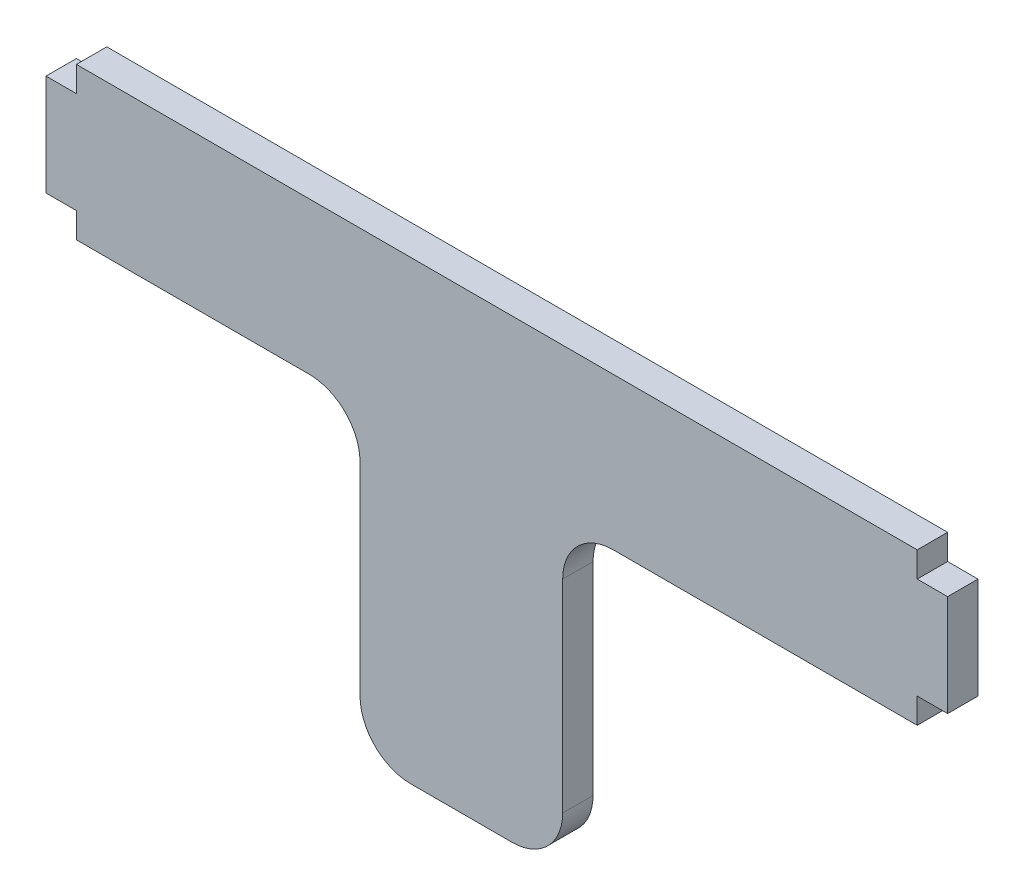
from build123d import *

# Parameters (mm, degrees)
RESSALTO_EXTRUS_O1_DEPTH = 3
FILETE1_R                = 5


with BuildPart() as part:
    # Esboço1 → Ressalto-extrusão1 (new body)
    with BuildSketch(Plane.XY):
        Polygon((6.5, -7.5), (41.5, -7.5), (41.5, -5), (44.5, -5), (44.5, 5), (41.5, 5), (41.5, 7.5), (-41.5, 7.5), (-41.5, 5), (-44.5, 5), (-44.5, -5), (-41.5, -5), (-41.5, -7.5), (-13.5, -7.5), (-13.5, -37.5), (6.5, -37.5), align=None)
    extrude(amount=RESSALTO_EXTRUS_O1_DEPTH)

    # Filete1
    filete1_edges = [part.edges().sort_by_distance(p)[0] for p in [
        (6.5, -37.5, 1.5),
        (-13.5, -37.5, 1.5),
        (-13.5, -7.5, 1.5),
        (6.5, -7.5, 1.5),
    ]]
    fillet(filete1_edges, radius=FILETE1_R)


solid = part.part
